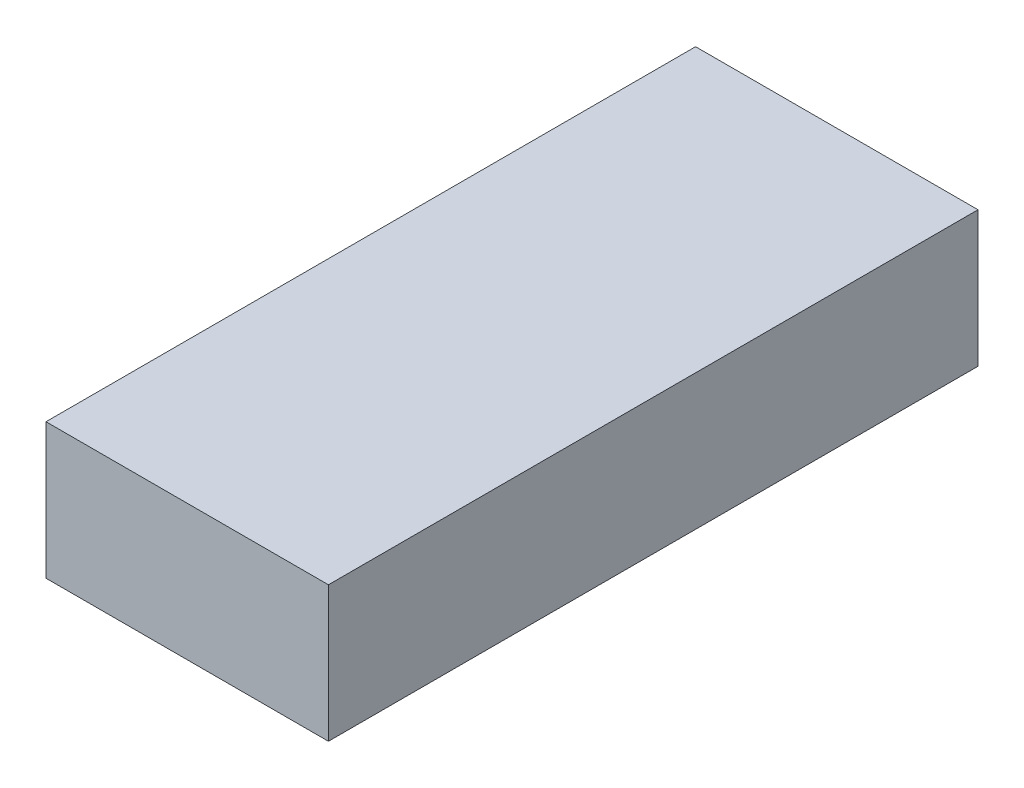
from build123d import *

# Parameters (mm, degrees)
SKETCH1_W           = 20
SKETCH1_H           = 42
BOSS_EXTRUDE1_DEPTH = 7.6
CUT_EXTRUDE1_DEPTH  = 4
THICKEN1_START      = -10
THICKEN1_DEPTH      = 20
SKETCH7_W           = 16
SKETCH7_H           = 1.6
CUT_EXTRUDE6_DEPTH  = 15


# Read off the part's stored shape, not the designer's step: Thicken1
with BuildPart() as part:
    # Sketch1 → Boss-Extrude1 (new body)
    with BuildSketch(Plane(origin=(0, 0, 0), x_dir=(1, 0, 0), z_dir=(0, 1, 0))):
        Rectangle(SKETCH1_W, SKETCH1_H)
    extrude(amount=BOSS_EXTRUDE1_DEPTH)

    # Sketch2 → Cut-Extrude1 (cut)
    with BuildSketch(Plane.XZ):
        with BuildLine():
            Line((-3.5, -17.5), (3.5, -17.5))
            Line((3.5, -17.5), (3.5, -5.5))
            ThreePointArc((3.5, -5.5), (4.085786438, -4.085786438), (5.5, -3.5))
            Line((5.5, -3.5), (8.5, -3.5))
            Line((8.5, -3.5), (8.5, 0.5))
            Line((8.5, 0.5), (5.5, 0.5))
            ThreePointArc((5.5, 0.5), (4.085786438, 1.085786438), (3.5, 2.5))
            Line((3.5, 2.5), (3.5, 17.5))
            Line((3.5, 17.5), (-3.5, 17.5))
            Line((-3.5, 17.5), (-3.5, 2.5))
            ThreePointArc((-3.5, 2.5), (-4.085786438, 1.085786438), (-5.5, 0.5))
            Line((-5.5, 0.5), (-8.5, 0.5))
            Line((-8.5, 0.5), (-8.5, -3.5))
            Line((-8.5, -3.5), (-5.5, -3.5))
            ThreePointArc((-5.5, -3.5), (-4.085786438, -4.085786438), (-3.5, -5.5))
            Line((-3.5, -5.5), (-3.5, -17.5))
        make_face()
    extrude(amount=-CUT_EXTRUDE1_DEPTH, mode=Mode.SUBTRACT)

    # Thicken1 outline → Thicken1 (add)
    with BuildSketch(Plane.YZ.offset(THICKEN1_START)):
        Polygon((0, -23), (9.6, -23), (9.6, 23), (0, 23), (0, 21), (7.6, 21), (7.6, -21), (0, -21), align=None)
    extrude(amount=THICKEN1_DEPTH)

    # Sketch7 → Cut-Extrude6 (cut)
    with BuildSketch(Plane(origin=(0, 0, -23), x_dir=(-1, 0, 0), z_dir=(0, 0, -1))):
        with Locations((0, 7.2)):
            Rectangle(SKETCH7_W, SKETCH7_H)
    extrude(amount=-CUT_EXTRUDE6_DEPTH, mode=Mode.SUBTRACT)


solid = part.part
